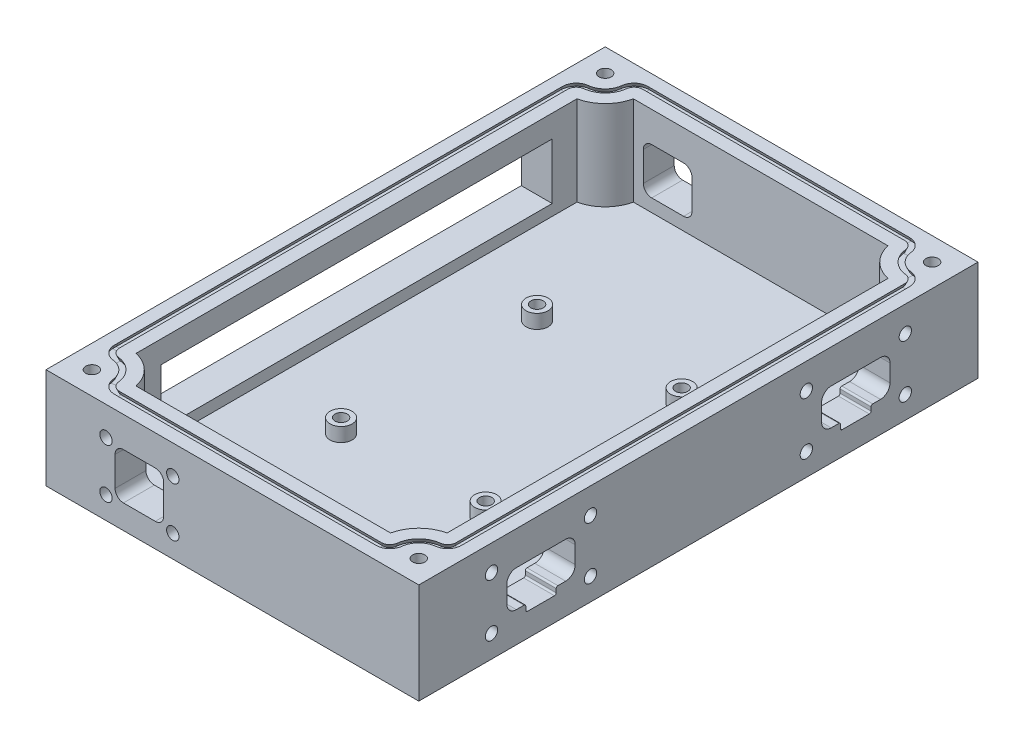
from build123d import *
from OCP.BRepAlgoAPI import BRepAlgoAPI_Cut
from OCP.TopTools import TopTools_ListOfShape

# Parameters (mm, degrees)
SKETCH1_W           = 169.3418
SKETCH1_H           = 254
BOSS_EXTRUDE1_DEPTH = 45.72
CUT_EXTRUDE1_DEPTH  = 40.64
SKETCH14_R          = 2.7999944
CUT_EXTRUDE11_DEPTH = 5.499989
CUT_EXTRUDE10_REACH = 310.679
F_12_PIN_MOUNT_R    = 2.7999944
CUT_EXTRUDE3_DEPTH  = 5.499989
CUT_EXTRUDE5_REACH  = 310.679
CUT_EXTRUDE6_START  = -254
CUT_EXTRUDE6_DEPTH  = 14.029233
SKETCH6_R           = 2.7999944
CUT_EXTRUDE7_DEPTH  = 5.499989
CUT_EXTRUDE8_START  = -248.500011
SKETCH6_2_R         = 2.7999944
CUT_EXTRUDE8_DEPTH  = 5.499989
SKETCH7_R           = 5
BOSS_EXTRUDE2_DEPTH = 6.35
CUT_EXTRUDE9_START  = 6.35
SKETCH8_R           = 2.7999944
CUT_EXTRUDE9_DEPTH  = 5.499989
CUT_EXTRUDE12_REACH = 310.679
SKETCH18_W          = 177.8
SKETCH18_H          = 25.4


with BuildPart() as part:
    # Sketch1 → Boss-Extrude1 (new body)
    with BuildSketch(Plane(origin=(0, 0, 0), x_dir=(1, 0, 0), z_dir=(0, 1, 0))):
        with Locations((84.6709, 127)):
            Rectangle(SKETCH1_W, SKETCH1_H)
    extrude(amount=BOSS_EXTRUDE1_DEPTH)

    # Sketch2 → Cut-Extrude1 (cut)
    with BuildSketch(Plane(origin=(0, 45.72, 0), x_dir=(1, 0, 0), z_dir=(0, 1, 0))):
        with BuildLine():
            Line((142.484144473, 239.970766692), (26.857655527, 239.970766692))
            ThreePointArc((26.857655527, 239.970766692), (22.320064794, 231.679935206), (14.029233308, 227.142344473))
            Line((14.029233308, 227.142344473), (14.029233308, 26.857655527))
            ThreePointArc((14.029233308, 26.857655527), (22.320064794, 22.320064794), (26.857655527, 14.029233308))
            Line((26.857655527, 14.029233308), (142.484144473, 14.029233308))
            ThreePointArc((142.484144473, 14.029233308), (147.021735206, 22.320064794), (155.312566692, 26.857655527))
            Line((155.312566692, 26.857655527), (155.312566692, 227.142344473))
            ThreePointArc((155.312566692, 227.142344473), (147.021735206, 231.679935206), (142.484144473, 239.970766692))
        make_face()
    extrude(amount=-CUT_EXTRUDE1_DEPTH, mode=Mode.SUBTRACT)

    # Cut-Sweep2: sweep along a path in Sketch3
    with BuildLine(Plane(origin=(0, 45.72, 0), x_dir=(1, 0, 0), z_dir=(0, 1, 0))) as cut_sweep2_path:
        Line((25.220177823, 246.985383346), (144.121622177, 246.985383346))
        ThreePointArc((144.121622177, 246.985383346), (147.505773519, 245.69404006), (149.169412611, 242.476532834))
        ThreePointArc((149.169412611, 242.476532834), (151.98181803, 236.64001803), (157.818332834, 233.827612611))
        ThreePointArc((157.818332834, 233.827612611), (161.03584006, 232.163973519), (162.327183346, 228.779822177))
        Line((162.327183346, 228.779822177), (162.327183346, 25.220177823))
        ThreePointArc((162.327183346, 25.220177823), (161.03584006, 21.836026481), (157.818332834, 20.172387389))
        ThreePointArc((157.818332834, 20.172387389), (151.98181803, 17.35998197), (149.169412611, 11.523467166))
        ThreePointArc((149.169412611, 11.523467166), (147.505773519, 8.30595994), (144.121622177, 7.014616654))
        Line((144.121622177, 7.014616654), (25.220177823, 7.014616654))
        ThreePointArc((25.220177823, 7.014616654), (21.836026481, 8.30595994), (20.172387389, 11.523467166))
        ThreePointArc((20.172387389, 11.523467166), (17.35998197, 17.35998197), (11.523467166, 20.172387389))
        ThreePointArc((11.523467166, 20.172387389), (8.30595994, 21.836026481), (7.014616654, 25.220177823))
        Line((7.014616654, 25.220177823), (7.014616654, 228.779822177))
        ThreePointArc((7.014616654, 228.779822177), (8.30595994, 232.163973519), (11.523467166, 233.827612611))
        ThreePointArc((11.523467166, 233.827612611), (17.35998197, 236.64001803), (20.172387389, 242.476532834))
        ThreePointArc((20.172387389, 242.476532834), (21.836026481, 245.69404006), (25.220177823, 246.985383346))
    # Sketch4 → Cut-Sweep2 (sweep, cut)
    with BuildSketch(Plane(origin=(6.185274227, 0, -26.857655527), x_dir=(1, 0, 0), z_dir=(0, 0, 1))):
        Polygon((-0.313657624, 45.72), (-1.105274227, 43.942), (2.763959081, 43.942), (1.972342479, 45.72), align=None)
    sweep(path=cut_sweep2_path.line, mode=Mode.SUBTRACT)

    # Sketch14 → Cut-Extrude11 (cut)
    with BuildSketch(Plane(origin=(0, 45.72, 0), x_dir=(1, 0, 0), z_dir=(0, 1, 0))):
        with Locations(Location((10.419999988, 243.580000012, 0), (0, 0, 270))):
            Circle(SKETCH14_R)
        with Locations(Location((158.921800012, 243.580000012, 0), (0, 0, 270))):
            Circle(SKETCH14_R)
        with Locations(Location((158.921800012, 10.419999988, 0), (0, 0, 270))):
            Circle(SKETCH14_R)
        with Locations(Location((10.419999988, 10.419999988, 0), (0, 0, 270))):
            Circle(SKETCH14_R)
    extrude(amount=-CUT_EXTRUDE11_DEPTH, mode=Mode.SUBTRACT)

    # Sketch13 → Cut-Extrude10 (cut, up to next)
    with BuildSketch(Plane(origin=(169.3418, 0, 0), x_dir=(0, 0, -1), z_dir=(1, 0, 0)), mode=Mode.PRIVATE) as cut_extrude10_sk1:
        with BuildLine():
            Line((48.5902, 13.0937), (48.5902, 11.4173))
            ThreePointArc((48.5902, 11.4173), (48.813384633, 10.878484633), (49.3522, 10.6553))
            Line((49.3522, 10.6553), (61.6458, 10.6553))
            ThreePointArc((61.6458, 10.6553), (62.184615367, 10.878484633), (62.4078, 11.4173))
            Line((62.4078, 11.4173), (62.4078, 13.0937))
            ThreePointArc((62.4078, 13.0937), (62.630984633, 13.632515367), (63.1698, 13.8557))
            Line((63.1698, 13.8557), (66.7004, 13.8557))
            ThreePointArc((66.7004, 13.8557), (69.771647593, 15.127852407), (71.0438, 18.1991))
            Line((71.0438, 18.1991), (71.0438, 25.9969))
            ThreePointArc((71.0438, 25.9969), (69.771647593, 29.068147593), (66.7004, 30.3403))
            Line((66.7004, 30.3403), (44.2976, 30.3403))
            ThreePointArc((44.2976, 30.3403), (41.226352407, 29.068147593), (39.9542, 25.9969))
            Line((39.9542, 25.9969), (39.9542, 18.1991))
            ThreePointArc((39.9542, 18.1991), (41.226352407, 15.127852407), (44.2976, 13.8557))
            Line((44.2976, 13.8557), (47.8282, 13.8557))
            ThreePointArc((47.8282, 13.8557), (48.367015367, 13.632515367), (48.5902, 13.0937))
        make_face()
    cut_extrude10_tool1 = extrude(cut_extrude10_sk1.sketch, amount=-CUT_EXTRUDE10_REACH, mode=Mode.PRIVATE) & part.part
    # Sketch13 → Cut-Extrude10 (cut, up to next)
    with BuildSketch(Plane(origin=(169.3418, 0, 0), x_dir=(0, 0, -1), z_dir=(1, 0, 0)), mode=Mode.PRIVATE) as cut_extrude10_sk2:
        with BuildLine():
            Line((191.5922, 13.0937), (191.5922, 11.4173))
            ThreePointArc((191.5922, 11.4173), (191.815384633, 10.878484633), (192.3542, 10.6553))
            Line((192.3542, 10.6553), (204.6478, 10.6553))
            ThreePointArc((204.6478, 10.6553), (205.186615367, 10.878484633), (205.4098, 11.4173))
            Line((205.4098, 11.4173), (205.4098, 13.0937))
            ThreePointArc((205.4098, 13.0937), (205.632984633, 13.632515367), (206.1718, 13.8557))
            Line((206.1718, 13.8557), (209.7024, 13.8557))
            ThreePointArc((209.7024, 13.8557), (212.773647593, 15.127852407), (214.0458, 18.1991))
            Line((214.0458, 18.1991), (214.0458, 25.9969))
            ThreePointArc((214.0458, 25.9969), (212.773647593, 29.068147593), (209.7024, 30.3403))
            Line((209.7024, 30.3403), (187.2996, 30.3403))
            ThreePointArc((187.2996, 30.3403), (184.228352407, 29.068147593), (182.9562, 25.9969))
            Line((182.9562, 25.9969), (182.9562, 18.1991))
            ThreePointArc((182.9562, 18.1991), (184.228352407, 15.127852407), (187.2996, 13.8557))
            Line((187.2996, 13.8557), (190.8302, 13.8557))
            ThreePointArc((190.8302, 13.8557), (191.369015367, 13.632515367), (191.5922, 13.0937))
        make_face()
    cut_extrude10_tool2 = extrude(cut_extrude10_sk2.sketch, amount=-CUT_EXTRUDE10_REACH, mode=Mode.PRIVATE) & part.part
    add(cut_extrude10_tool1.solids().sort_by_distance((169.3418, 21.29408, -55.499))[0], mode=Mode.SUBTRACT)
    add(cut_extrude10_tool2.solids().sort_by_distance((169.3418, 21.29408, -198.501))[0], mode=Mode.SUBTRACT)

    # 12 pin mount → Cut-Extrude3 (cut)
    with BuildSketch(Plane(origin=(169.3418, 0, 0), x_dir=(0, 0, -1), z_dir=(1, 0, 0))):
        with Locations((77.978, 34.036)):
            Circle(F_12_PIN_MOUNT_R)
        with Locations((176.022, 10.16)):
            Circle(F_12_PIN_MOUNT_R)
        with Locations((33.02, 10.16)):
            Circle(F_12_PIN_MOUNT_R)
        with Locations((77.978, 10.16)):
            Circle(F_12_PIN_MOUNT_R)
        with Locations((220.98, 34.036)):
            Circle(F_12_PIN_MOUNT_R)
        with Locations((220.98, 10.16)):
            Circle(F_12_PIN_MOUNT_R)
        with Locations((176.022, 34.036)):
            Circle(F_12_PIN_MOUNT_R)
        with Locations((33.02, 34.036)):
            Circle(F_12_PIN_MOUNT_R)
    extrude(amount=-CUT_EXTRUDE3_DEPTH, mode=Mode.SUBTRACT)

    # 4 pin connector → Cut-Extrude5 (cut, up to next)
    with BuildSketch(Plane.XY, mode=Mode.PRIVATE) as cut_extrude5_sk1:
        with BuildLine():
            Line((35.1663, 31.877), (49.6443, 31.877))
            ThreePointArc((49.6443, 31.877), (52.338376836, 30.761076836), (53.4543, 28.067))
            Line((53.4543, 28.067), (53.4543, 14.7066))
            ThreePointArc((53.4543, 14.7066), (52.338376836, 12.012523164), (49.6443, 10.8966))
            Line((49.6443, 10.8966), (35.1663, 10.8966))
            ThreePointArc((35.1663, 10.8966), (32.472223164, 12.012523164), (31.3563, 14.7066))
            Line((31.3563, 14.7066), (31.3563, 28.067))
            ThreePointArc((31.3563, 28.067), (32.472223164, 30.761076836), (35.1663, 31.877))
        make_face()
    cut_extrude5_tool1 = extrude(cut_extrude5_sk1.sketch, amount=-CUT_EXTRUDE5_REACH, mode=Mode.PRIVATE) & part.part
    add(cut_extrude5_tool1.solids().sort_by_distance((42.4053, 21.3868, 0))[0], mode=Mode.SUBTRACT)


with BuildPart() as cut_extrude6_tool:
    # Sketch5<2> → Cut-Extrude6 (new body)
    with BuildSketch(Plane.XY.offset(CUT_EXTRUDE6_START)):
        with BuildLine():
            Line((35.1663, 31.877), (49.6443, 31.877))
            ThreePointArc((49.6443, 31.877), (52.338376836, 30.761076836), (53.4543, 28.067))
            Line((53.4543, 28.067), (53.4543, 14.7066))
            ThreePointArc((53.4543, 14.7066), (52.338376836, 12.012523164), (49.6443, 10.8966))
            Line((49.6443, 10.8966), (35.1663, 10.8966))
            ThreePointArc((35.1663, 10.8966), (32.472223164, 12.012523164), (31.3563, 14.7066))
            Line((31.3563, 14.7066), (31.3563, 28.067))
            ThreePointArc((31.3563, 28.067), (32.472223164, 30.761076836), (35.1663, 31.877))
        make_face()
    extrude(amount=CUT_EXTRUDE6_DEPTH)


with BuildPart() as part_1:
    add(part.part)

    # Cut-Extrude6: cut by cut_extrude6_tool, with a tolerance
    cut_extrude6_stock = TopTools_ListOfShape()
    cut_extrude6_stock.Append(part_1.part.wrapped)
    cut_extrude6_tools = TopTools_ListOfShape()
    cut_extrude6_tools.Append(cut_extrude6_tool.part.wrapped)
    cut_extrude6_cut = BRepAlgoAPI_Cut()
    cut_extrude6_cut.SetArguments(cut_extrude6_stock)
    cut_extrude6_cut.SetTools(cut_extrude6_tools)
    cut_extrude6_cut.SetFuzzyValue(0.00001)
    cut_extrude6_cut.Build()
    add(Compound.cast(cut_extrude6_cut.Shape()).solids(), mode=Mode.REPLACE)

    # Sketch6 → Cut-Extrude7 (cut)
    with BuildSketch(Plane.XY):
        with Locations((57.5818, 32.6136)):
            Circle(SKETCH6_R)
        with Locations((57.5818, 10.16)):
            Circle(SKETCH6_R)
        with Locations((27.2288, 10.16)):
            Circle(SKETCH6_R)
        with Locations((27.2288, 32.6136)):
            Circle(SKETCH6_R)
    extrude(amount=-CUT_EXTRUDE7_DEPTH, mode=Mode.SUBTRACT)

    # Sketch6<2> → Cut-Extrude8 (cut)
    with BuildSketch(Plane.XY.offset(CUT_EXTRUDE8_START)):
        with Locations((57.5818, 32.6136)):
            Circle(SKETCH6_2_R)
        with Locations((57.5818, 10.16)):
            Circle(SKETCH6_2_R)
        with Locations((27.2288, 10.16)):
            Circle(SKETCH6_2_R)
        with Locations((27.2288, 32.6136)):
            Circle(SKETCH6_2_R)
    extrude(amount=-CUT_EXTRUDE8_DEPTH, mode=Mode.SUBTRACT)

    # Sketch7 → Boss-Extrude2 (add)
    with BuildSketch(Plane(origin=(0, 5.08, 0), x_dir=(1, 0, 0), z_dir=(0, 1, 0))):
        with Locations(Location((51.552566692, 82.485, 0), (0, 0, 90))):
            Circle(SKETCH7_R)
        with Locations(Location((117.212566692, 82.485, 0), (0, 0, 90))):
            Circle(SKETCH7_R)
        with Locations(Location((117.212566692, 171.515, 0), (0, 0, 90))):
            Circle(SKETCH7_R)
        with Locations(Location((51.552566692, 171.515, 0), (0, 0, 90))):
            Circle(SKETCH7_R)
    extrude(amount=BOSS_EXTRUDE2_DEPTH)

    # Sketch8 → Cut-Extrude9 (cut)
    with BuildSketch(Plane(origin=(0, 5.08, 0), x_dir=(1, 0, 0), z_dir=(0, 1, 0)).offset(CUT_EXTRUDE9_START)):
        with Locations(Location((51.552566692, 171.515, 0), (0, 0, 270))):
            Circle(SKETCH8_R)
        with Locations(Location((117.212566692, 171.515, 0), (0, 0, 270))):
            Circle(SKETCH8_R)
        with Locations(Location((117.212566692, 82.485, 0), (0, 0, 270))):
            Circle(SKETCH8_R)
        with Locations(Location((51.552566692, 82.485, 0), (0, 0, 270))):
            Circle(SKETCH8_R)
    extrude(amount=-CUT_EXTRUDE9_DEPTH, mode=Mode.SUBTRACT)

    # Sketch18 → Cut-Extrude12 (cut, up to next)
    with BuildSketch(Plane.ZY, mode=Mode.PRIVATE) as cut_extrude12_sk1:
        with Locations((-127, 22.86)):
            Rectangle(SKETCH18_W, SKETCH18_H)
    cut_extrude12_tool1 = extrude(cut_extrude12_sk1.sketch, amount=-CUT_EXTRUDE12_REACH, mode=Mode.PRIVATE) & part_1.part
    add(cut_extrude12_tool1.solids().sort_by_distance((0, 22.86, -127))[0], mode=Mode.SUBTRACT)


solid = part_1.part
